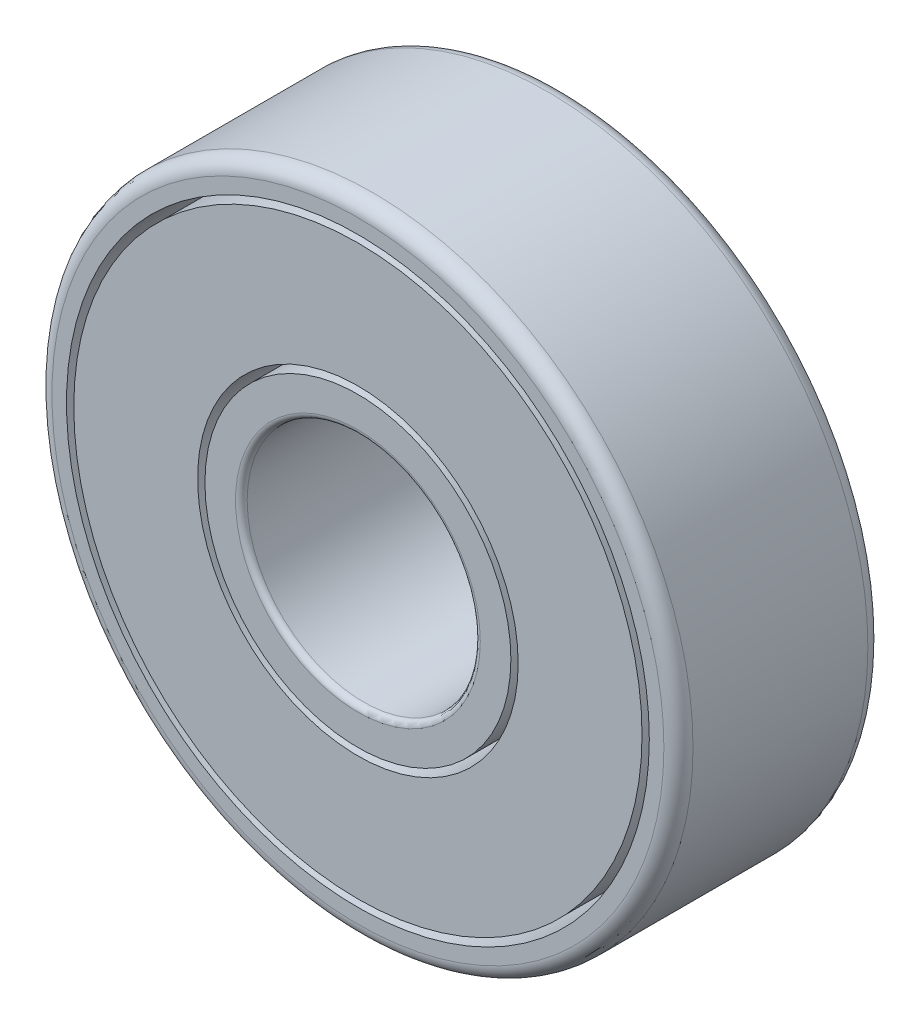
from build123d import *

# Parameters (mm, degrees)
CROQUIS1_R                = 5.25
CROQUIS1_R_2              = 4
SALIENTE_EXTRUIR1_DEPTH   = 7
CROQUIS1_R_3              = 9.75
CROQUIS1_R_4              = 5.5
SALIENTE_EXTRUIR1_2_DEPTH = 7
CROQUIS1_R_5              = 11
CROQUIS1_R_6              = 10
SALIENTE_EXTRUIR1_3_DEPTH = 7
REDONDEO1_R               = 0.2
REDONDEO2_R               = 0.5


with BuildPart() as part:
    # Croquis1 → Saliente-Extruir1 (new body)
    with BuildSketch(Plane.XY):
        Circle(CROQUIS1_R)
        Circle(CROQUIS1_R_2, mode=Mode.SUBTRACT)
    extrude(amount=SALIENTE_EXTRUIR1_DEPTH)

    # Redondeo1
    redondeo1_edges = [part.edges().sort_by_distance(p)[0] for p in [
        (-4, 0, 0),
        (-4, 0, 7),
    ]]
    fillet(redondeo1_edges, radius=REDONDEO1_R)


with BuildPart() as body_2:
    # Croquis1 → Saliente-Extruir1 2 (new body)
    with BuildSketch(Plane.XY):
        Circle(CROQUIS1_R_3)
        Circle(CROQUIS1_R_4, mode=Mode.SUBTRACT)
    extrude(amount=SALIENTE_EXTRUIR1_2_DEPTH)


with BuildPart() as body_3:
    # Croquis1 → Saliente-Extruir1 3 (new body)
    with BuildSketch(Plane.XY):
        Circle(CROQUIS1_R_5)
        Circle(CROQUIS1_R_6, mode=Mode.SUBTRACT)
    extrude(amount=SALIENTE_EXTRUIR1_3_DEPTH)

    # Redondeo2
    redondeo2_edges = [body_3.edges().sort_by_distance(p)[0] for p in [
        (-11, 0, 0),
        (-11, 0, 7),
    ]]
    fillet(redondeo2_edges, radius=REDONDEO2_R)


solid = Compound([part.part, body_2.part, body_3.part])
